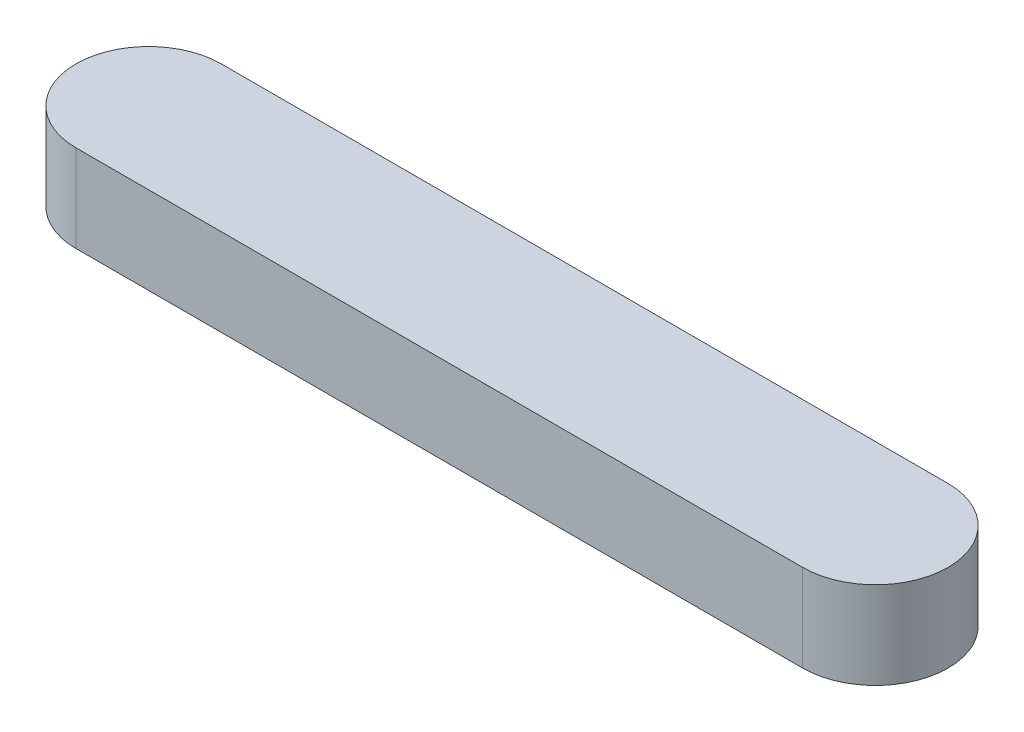
from build123d import *

# Parameters (mm, degrees)
BOSS_EXTRU_1_DEPTH = 12


with BuildPart() as part:
    # Esquisse1 → Boss.-Extru.1 (new body)
    with BuildSketch(Plane(origin=(0, 0, 0), x_dir=(1, 0, 0), z_dir=(0, 1, 0))):
        with BuildLine():
            Line((50, -10), (-50, -10))
            ThreePointArc((-50, -10), (-60, 0), (-50, 10))
            Line((-50, 10), (50, 10))
            ThreePointArc((50, 10), (60, 0), (50, -10))
        make_face()
    extrude(amount=BOSS_EXTRU_1_DEPTH)


solid = part.part
